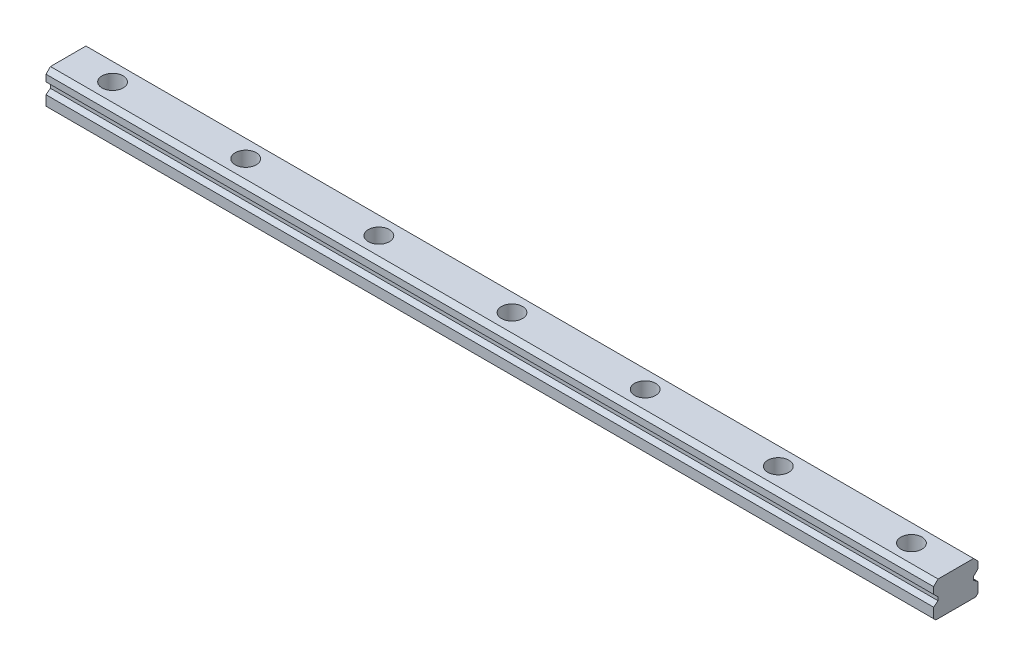
from build123d import *

# Parameters (mm, degrees)
BOSS_EXTRUDE1_DEPTH = 400
SKETCH2_R           = 4.75
CUT_EXTRUDE1_DEPTH  = 8.5
SKETCH3_R           = 3
CUT_EXTRUDE2_DEPTH  = 401.215254582
LPATTERN1_COUNT     = 7
LPATTERN1_PITCH     = 60


with BuildPart() as part:
    # Sketch1 → Boss-Extrude1 (new body)
    with BuildSketch(Plane(origin=(0, 0, 0), x_dir=(0, 0, -1), z_dir=(1, 0, 0))):
        Polygon((9, 0), (-9, 0), (-10, 1), (-10, 5.5), (-8, 7), (-8, 8.5), (-10, 10.5), (-10, 13.5), (-8, 15.5), (8, 15.5), (10, 13.5), (10, 10.5), (8, 8.5), (8, 7), (10, 5.5), (10, 1), align=None)
    extrude(amount=BOSS_EXTRUDE1_DEPTH)

    # Sketch2 → Cut-Extrude1 (cut)
    with BuildSketch(Plane(origin=(0, 15.5, 0), x_dir=(1, 0, 0), z_dir=(0, 1, 0))):
        with Locations((20, 0)):
            Circle(SKETCH2_R)
    cut_extrude1 = extrude(amount=-CUT_EXTRUDE1_DEPTH, mode=Mode.SUBTRACT)

    # Sketch3 → Cut-Extrude2 (cut, through all)
    with BuildSketch(Plane(origin=(0, 7, 0), x_dir=(1, 0, 0), z_dir=(0, 1, 0))):
        with Locations((20, 0)):
            Circle(SKETCH3_R)
    cut_extrude2 = extrude(amount=-CUT_EXTRUDE2_DEPTH, mode=Mode.SUBTRACT)

    # LPattern1: Cut-Extrude1, Cut-Extrude2 ×7
    with Locations(*[(i * LPATTERN1_PITCH, 0, 0) for i in range(1, LPATTERN1_COUNT)]):
        add(cut_extrude1, mode=Mode.SUBTRACT)
        add(cut_extrude2, mode=Mode.SUBTRACT)


solid = part.part
